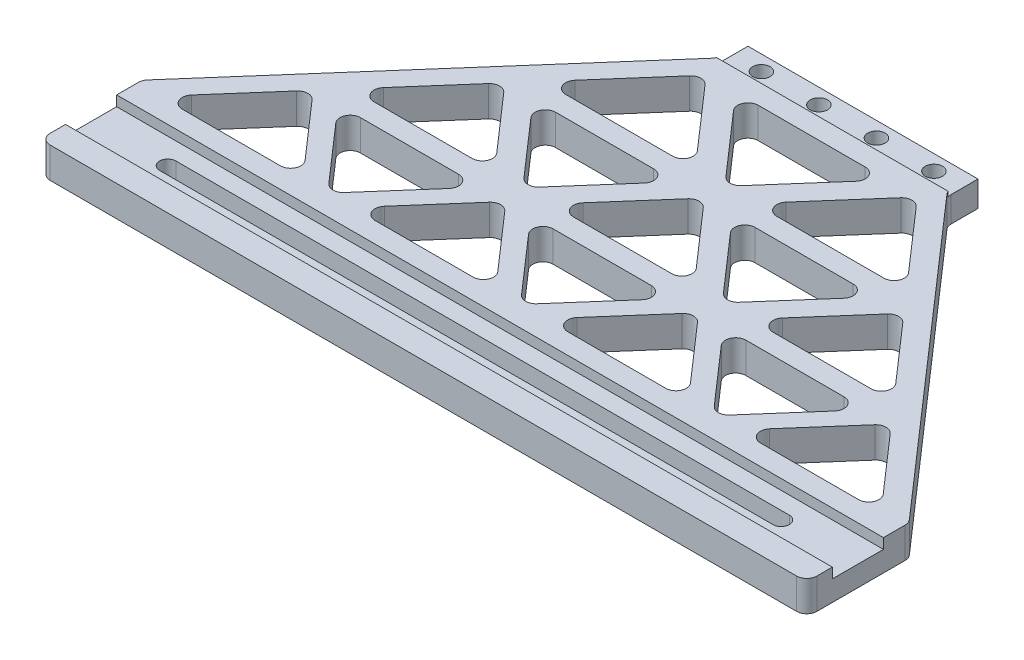
from build123d import *

# Parameters (mm, degrees)
EXTRUDE_1_DEPTH     = 6
SKETCH_2_W          = 150
SKETCH_2_H          = 10
CUT_EXTRUDE_1_DEPTH = 2
FILLET_3_R          = 2
SKETCH_3_W          = 47
SKETCH_3_H          = 6
CUT_EXTRUDE_2_DEPTH = 1
HOLE_WIZARD_M31_D   = 3.4
CUT_EXTRUDE_3_DEPTH = 112.937482552
CUT_EXTRUDE_4_REACH = 114.027
FILLET_1_R          = 2


with BuildPart() as part:
    # Эскиз1 → Бобышка-Вытянуть1 (new body)
    with BuildSketch(Plane(origin=(0, 0, 0), x_dir=(1, 0, 0), z_dir=(0, 1, 0))):
        Polygon((-22.5, 3), (22.5, 3), (22.5, -3), (75, -63), (75, -83), (-75, -83), (-75, -63), (-22.5, -3), align=None)
    extrude(amount=EXTRUDE_1_DEPTH)

    # Эскиз2 → Вырез-Вытянуть1 (cut)
    with BuildSketch(Plane(origin=(0, 6, 0), x_dir=(1, 0, 0), z_dir=(0, 1, 0))):
        with Locations((0, -73)):
            Rectangle(SKETCH_2_W, SKETCH_2_H)
    extrude(amount=-CUT_EXTRUDE_1_DEPTH, mode=Mode.SUBTRACT)

    # Скругление3
    fillet_3_edges = [part.edges().sort_by_distance(p)[0] for p in [
        (22.5, 3, 3),
        (-22.5, 3, 3),
    ]]
    fillet(fillet_3_edges, radius=FILLET_3_R)

    # Эскиз3 → Вырез-Вытянуть2 (cut)
    with BuildSketch(Plane(origin=(0, 6, 0), x_dir=(1, 0, 0), z_dir=(0, 1, 0))):
        Rectangle(SKETCH_3_W, SKETCH_3_H)
    extrude(amount=-CUT_EXTRUDE_2_DEPTH, mode=Mode.SUBTRACT)

    # Отверстие с зазором M31 (through all)
    with Locations(Plane(origin=(0, 0, 0), x_dir=(-1, 0, 0), z_dir=(0, -1, 0))):
        with Locations((-5.625, 0), (5.625, 0), (16.875, 0), (-16.875, 0)):
            Hole(HOLE_WIZARD_M31_D / 2)

    # Эскиз9 → Вырез-Вытянуть3 (cut, through all)
    with BuildSketch(Plane(origin=(0, 4, 0), x_dir=(1, 0, 0), z_dir=(0, 1, 0))):
        with BuildLine():
            Line((-60, -71.4), (60, -71.4))
            ThreePointArc((60, -71.4), (61.6, -73), (60, -74.6))
            Line((60, -74.6), (-60, -74.6))
            ThreePointArc((-60, -74.6), (-61.6, -73), (-60, -71.4))
        make_face()
    extrude(amount=-CUT_EXTRUDE_3_DEPTH, mode=Mode.SUBTRACT)

    # Эскиз10 → Вырез-Вытянуть4 (cut, up to next)
    with BuildSketch(Plane(origin=(0, 6, 0), x_dir=(1, 0, 0), z_dir=(0, 1, 0)), mode=Mode.PRIVATE) as cut_extrude_4_sk1:
        Polygon((-70.559927094, -64), (-56.559927094, -48), (-42.559927094, -64), align=None)
    cut_extrude_4_tool1 = extrude(cut_extrude_4_sk1.sketch, amount=-CUT_EXTRUDE_4_REACH, mode=Mode.PRIVATE) & part.part
    # Эскиз10 → Вырез-Вытянуть4 (cut, up to next)
    with BuildSketch(Plane(origin=(0, 6, 0), x_dir=(1, 0, 0), z_dir=(0, 1, 0)), mode=Mode.PRIVATE) as cut_extrude_4_sk2:
        Polygon((-51.709923067, -48), (-37.709923067, -64), (-23.709923067, -48), align=None)
    cut_extrude_4_tool2 = extrude(cut_extrude_4_sk2.sketch, amount=-CUT_EXTRUDE_4_REACH, mode=Mode.PRIVATE) & part.part
    # Эскиз10 → Вырез-Вытянуть4 (cut, up to next)
    with BuildSketch(Plane(origin=(0, 6, 0), x_dir=(1, 0, 0), z_dir=(0, 1, 0)), mode=Mode.PRIVATE) as cut_extrude_4_sk3:
        Polygon((-18.85991904, -48), (-32.85991904, -64), (-4.85991904, -64), align=None)
    cut_extrude_4_tool3 = extrude(cut_extrude_4_sk3.sketch, amount=-CUT_EXTRUDE_4_REACH, mode=Mode.PRIVATE) & part.part
    # Эскиз10 → Вырез-Вытянуть4 (cut, up to next)
    with BuildSketch(Plane(origin=(0, 6, 0), x_dir=(1, 0, 0), z_dir=(0, 1, 0)), mode=Mode.PRIVATE) as cut_extrude_4_sk4:
        Polygon((-14.009915012, -48), (-0.009915012, -64), (13.990084988, -48), align=None)
    cut_extrude_4_tool4 = extrude(cut_extrude_4_sk4.sketch, amount=-CUT_EXTRUDE_4_REACH, mode=Mode.PRIVATE) & part.part
    # Эскиз10 → Вырез-Вытянуть4 (cut, up to next)
    with BuildSketch(Plane(origin=(0, 6, 0), x_dir=(1, 0, 0), z_dir=(0, 1, 0)), mode=Mode.PRIVATE) as cut_extrude_4_sk5:
        Polygon((18.840089015, -48), (4.840089015, -64), (32.840089015, -64), align=None)
    cut_extrude_4_tool5 = extrude(cut_extrude_4_sk5.sketch, amount=-CUT_EXTRUDE_4_REACH, mode=Mode.PRIVATE) & part.part
    # Эскиз10 → Вырез-Вытянуть4 (cut, up to next)
    with BuildSketch(Plane(origin=(0, 6, 0), x_dir=(1, 0, 0), z_dir=(0, 1, 0)), mode=Mode.PRIVATE) as cut_extrude_4_sk6:
        Polygon((23.690093042, -48), (37.690093042, -64), (51.690093042, -48), align=None)
    cut_extrude_4_tool6 = extrude(cut_extrude_4_sk6.sketch, amount=-CUT_EXTRUDE_4_REACH, mode=Mode.PRIVATE) & part.part
    # Эскиз10 → Вырез-Вытянуть4 (cut, up to next)
    with BuildSketch(Plane(origin=(0, 6, 0), x_dir=(1, 0, 0), z_dir=(0, 1, 0)), mode=Mode.PRIVATE) as cut_extrude_4_sk7:
        Polygon((42.540097069, -64), (70.540097069, -64), (56.540097069, -48), align=None)
    cut_extrude_4_tool7 = extrude(cut_extrude_4_sk7.sketch, amount=-CUT_EXTRUDE_4_REACH, mode=Mode.PRIVATE) & part.part
    # Эскиз10 → Вырез-Вытянуть4 (cut, up to next)
    with BuildSketch(Plane(origin=(0, 6, 0), x_dir=(1, 0, 0), z_dir=(0, 1, 0)), mode=Mode.PRIVATE) as cut_extrude_4_sk8:
        Polygon((-53.059927094, -44), (-39.059927094, -28), (-25.059927094, -44), align=None)
    cut_extrude_4_tool8 = extrude(cut_extrude_4_sk8.sketch, amount=-CUT_EXTRUDE_4_REACH, mode=Mode.PRIVATE) & part.part
    # Эскиз10 → Вырез-Вытянуть4 (cut, up to next)
    with BuildSketch(Plane(origin=(0, 6, 0), x_dir=(1, 0, 0), z_dir=(0, 1, 0)), mode=Mode.PRIVATE) as cut_extrude_4_sk9:
        Polygon((-33.545538953, -28), (-19.545538953, -44), (-5.545538953, -28), align=None)
    cut_extrude_4_tool9 = extrude(cut_extrude_4_sk9.sketch, amount=-CUT_EXTRUDE_4_REACH, mode=Mode.PRIVATE) & part.part
    # Эскиз10 → Вырез-Вытянуть4 (cut, up to next)
    with BuildSketch(Plane(origin=(0, 6, 0), x_dir=(1, 0, 0), z_dir=(0, 1, 0)), mode=Mode.PRIVATE) as cut_extrude_4_sk10:
        Polygon((-0.031150813, -28), (-14.031150813, -44), (13.968849187, -44), align=None)
    cut_extrude_4_tool10 = extrude(cut_extrude_4_sk10.sketch, amount=-CUT_EXTRUDE_4_REACH, mode=Mode.PRIVATE) & part.part
    # Эскиз10 → Вырез-Вытянуть4 (cut, up to next)
    with BuildSketch(Plane(origin=(0, 6, 0), x_dir=(1, 0, 0), z_dir=(0, 1, 0)), mode=Mode.PRIVATE) as cut_extrude_4_sk11:
        Polygon((5.483237327, -28), (19.483237327, -44), (33.483237327, -28), align=None)
    cut_extrude_4_tool11 = extrude(cut_extrude_4_sk11.sketch, amount=-CUT_EXTRUDE_4_REACH, mode=Mode.PRIVATE) & part.part
    # Эскиз10 → Вырез-Вытянуть4 (cut, up to next)
    with BuildSketch(Plane(origin=(0, 6, 0), x_dir=(1, 0, 0), z_dir=(0, 1, 0)), mode=Mode.PRIVATE) as cut_extrude_4_sk12:
        Polygon((24.997625468, -44), (38.997625468, -28), (52.997625468, -44), align=None)
    cut_extrude_4_tool12 = extrude(cut_extrude_4_sk12.sketch, amount=-CUT_EXTRUDE_4_REACH, mode=Mode.PRIVATE) & part.part
    # Эскиз10 → Вырез-Вытянуть4 (cut, up to next)
    with BuildSketch(Plane(origin=(0, 6, 0), x_dir=(1, 0, 0), z_dir=(0, 1, 0)), mode=Mode.PRIVATE) as cut_extrude_4_sk13:
        Polygon((-35.559927094, -24), (-20.684927094, -7), (-5.809927094, -24), align=None)
    cut_extrude_4_tool13 = extrude(cut_extrude_4_sk13.sketch, amount=-CUT_EXTRUDE_4_REACH, mode=Mode.PRIVATE) & part.part
    # Эскиз10 → Вырез-Вытянуть4 (cut, up to next)
    with BuildSketch(Plane(origin=(0, 6, 0), x_dir=(1, 0, 0), z_dir=(0, 1, 0)), mode=Mode.PRIVATE) as cut_extrude_4_sk14:
        Polygon((-14.904785308, -7), (-0.029785308, -24), (14.845214692, -7), align=None)
    cut_extrude_4_tool14 = extrude(cut_extrude_4_sk14.sketch, amount=-CUT_EXTRUDE_4_REACH, mode=Mode.PRIVATE) & part.part
    # Эскиз10 → Вырез-Вытянуть4 (cut, up to next)
    with BuildSketch(Plane(origin=(0, 6, 0), x_dir=(1, 0, 0), z_dir=(0, 1, 0)), mode=Mode.PRIVATE) as cut_extrude_4_sk15:
        Polygon((20.625356478, -7), (5.750356478, -24), (35.500356478, -24), align=None)
    cut_extrude_4_tool15 = extrude(cut_extrude_4_sk15.sketch, amount=-CUT_EXTRUDE_4_REACH, mode=Mode.PRIVATE) & part.part
    add(cut_extrude_4_tool1.solids().sort_by_distance((-56.559927, 6, 58.666667))[0], mode=Mode.SUBTRACT)
    add(cut_extrude_4_tool2.solids().sort_by_distance((-37.709923, 6, 53.333333))[0], mode=Mode.SUBTRACT)
    add(cut_extrude_4_tool3.solids().sort_by_distance((-18.859919, 6, 58.666667))[0], mode=Mode.SUBTRACT)
    add(cut_extrude_4_tool4.solids().sort_by_distance((-0.009915, 6, 53.333333))[0], mode=Mode.SUBTRACT)
    add(cut_extrude_4_tool5.solids().sort_by_distance((18.840089, 6, 58.666667))[0], mode=Mode.SUBTRACT)
    add(cut_extrude_4_tool6.solids().sort_by_distance((37.690093, 6, 53.333333))[0], mode=Mode.SUBTRACT)
    add(cut_extrude_4_tool7.solids().sort_by_distance((56.540097, 6, 58.666667))[0], mode=Mode.SUBTRACT)
    add(cut_extrude_4_tool8.solids().sort_by_distance((-39.059927, 6, 38.666667))[0], mode=Mode.SUBTRACT)
    add(cut_extrude_4_tool9.solids().sort_by_distance((-19.545539, 6, 33.333333))[0], mode=Mode.SUBTRACT)
    add(cut_extrude_4_tool10.solids().sort_by_distance((-0.031151, 6, 38.666667))[0], mode=Mode.SUBTRACT)
    add(cut_extrude_4_tool11.solids().sort_by_distance((19.483237, 6, 33.333333))[0], mode=Mode.SUBTRACT)
    add(cut_extrude_4_tool12.solids().sort_by_distance((38.997625, 6, 38.666667))[0], mode=Mode.SUBTRACT)
    add(cut_extrude_4_tool13.solids().sort_by_distance((-20.684927, 6, 18.333333))[0], mode=Mode.SUBTRACT)
    add(cut_extrude_4_tool14.solids().sort_by_distance((-0.029785, 6, 12.666667))[0], mode=Mode.SUBTRACT)
    add(cut_extrude_4_tool15.solids().sort_by_distance((20.625356, 6, 18.333333))[0], mode=Mode.SUBTRACT)

    # Скругление1
    fillet_1_edges = [part.edges().sort_by_distance(p)[0] for p in [
        (18.840089015, 3, 48),
        (23.690093042, 3, 48),
        (-14.009915012, 3, 48),
        (-51.709923067, 3, 48),
        (-33.545538953, 3, 28),
        (5.483237327, 3, 28),
        (5.750356478, 3, 24),
        (24.997625468, 3, 44),
        (4.840089015, 3, 64),
        (-32.85991904, 3, 64),
        (-70.559927094, 3, 64),
        (-14.031150813, 3, 44),
        (-53.059927094, 3, 44),
        (-35.559927094, 3, 24),
        (-42.559927094, 3, 64),
        (-25.059927094, 3, 44),
        (-4.85991904, 3, 64),
        (35.500356478, 3, 24),
        (52.997625468, 3, 44),
        (70.540097069, 3, 64),
        (32.840089015, 3, 64),
        (13.968849187, 3, 44),
        (-5.809927094, 3, 24),
        (-0.029785308, 3, 24),
        (-37.709923067, 3, 64),
        (-0.009915012, 3, 64),
        (19.483237327, 3, 44),
        (37.690093042, 3, 64),
        (56.540097069, 3, 48),
        (38.997625468, 3, 28),
        (-0.031150813, 3, 28),
        (-18.85991904, 3, 48),
        (-56.559927094, 3, 48),
        (-39.059927094, 3, 28),
        (-20.684927094, 3, 7),
        (20.625356478, 3, 7),
        (-23.709923067, 3, 48),
        (13.990084988, 3, 48),
        (-5.545538953, 3, 28),
        (51.690093042, 3, 48),
        (33.483237327, 3, 28),
        (14.845214692, 3, 7),
        (-75, 3, 63),
        (-75, 3, 83),
        (75, 3, 83),
        (75, 3, 63),
        (-19.545538953, 3, 44),
        (42.540097069, 3, 64),
        (-14.904785308, 3, 7),
    ]]
    fillet(fillet_1_edges, radius=FILLET_1_R)


solid = part.part
